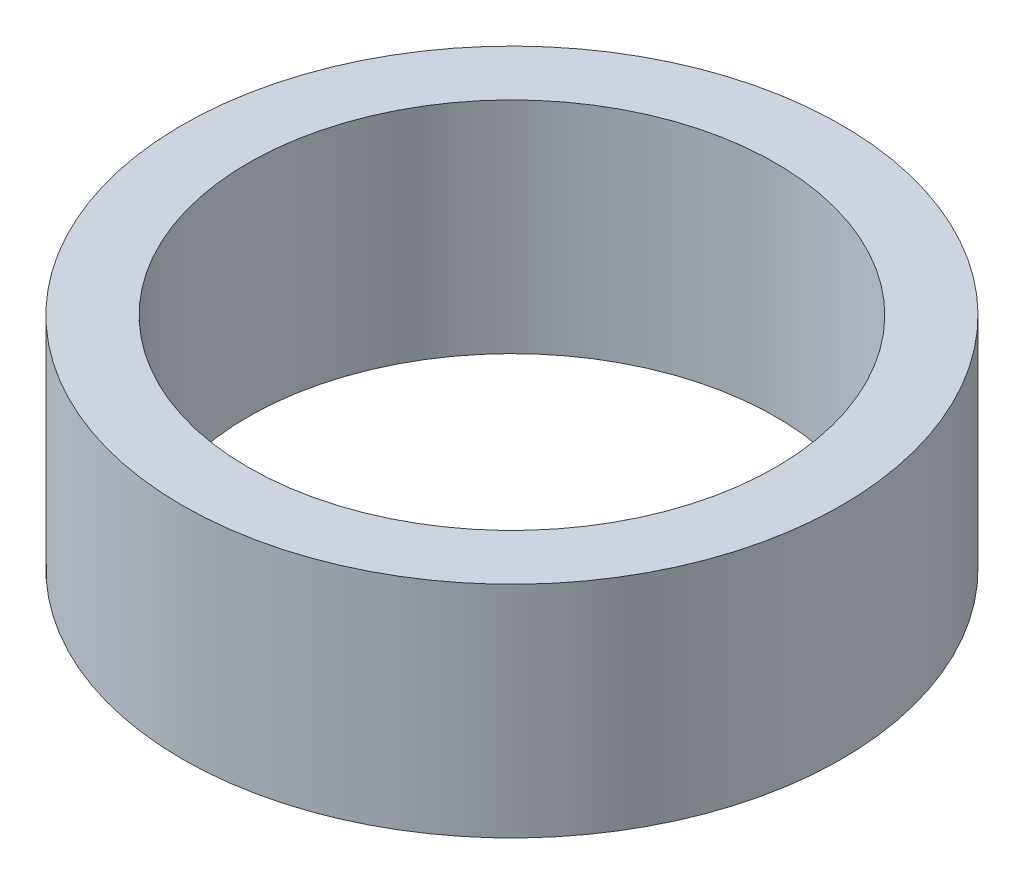
from build123d import *

# Parameters (mm, degrees)
SKETCH1_R           = 37.5
BOSS_EXTRUDE1_DEPTH = 25
SKETCH2_R           = 30
CUT_EXTRUDE1_DEPTH  = 59.630196998


with BuildPart() as part:
    # Sketch1 → Boss-Extrude1 (new body)
    with BuildSketch(Plane(origin=(0, 0, 0), x_dir=(1, 0, 0), z_dir=(0, 1, 0))):
        Circle(SKETCH1_R)
    extrude(amount=BOSS_EXTRUDE1_DEPTH)

    # Sketch2 → Cut-Extrude1 (cut, through all)
    with BuildSketch(Plane(origin=(0, 0, 0), x_dir=(1, 0, 0), z_dir=(0, 1, 0))):
        Circle(SKETCH2_R)
    extrude(amount=CUT_EXTRUDE1_DEPTH, mode=Mode.SUBTRACT)


solid = part.part
